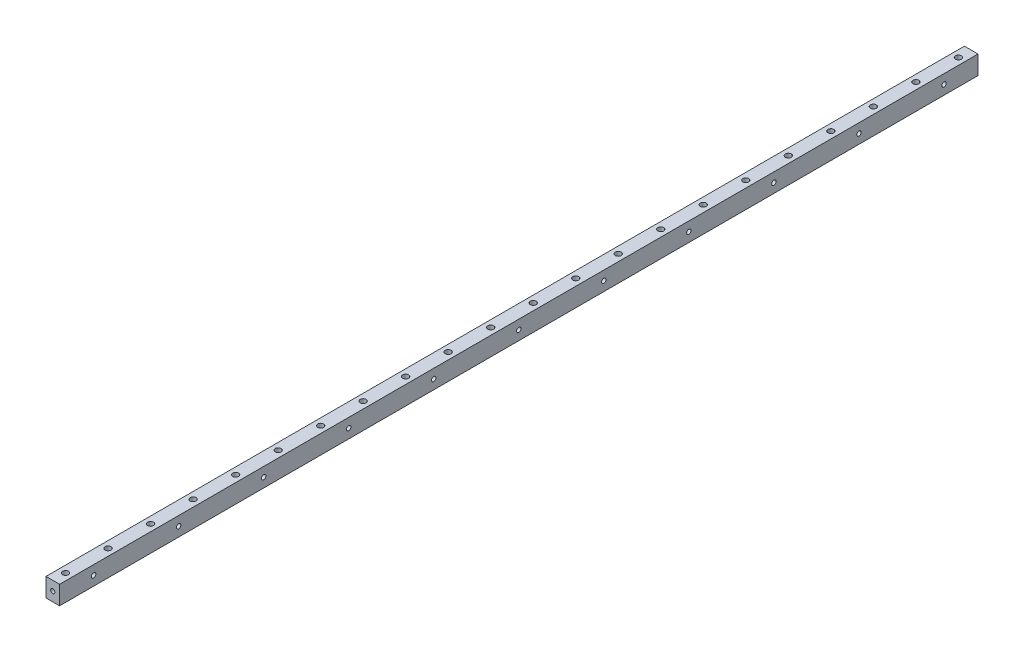
from build123d import *

# Parameters (mm, degrees)
SKETCH1_W             = 8
SKETCH1_H             = 11
BOSS_EXTRUDE1_DEPTH   = 540
SKETCH2_R             = 1.75
CUT_EXTRUDE1_DEPTH    = 541.126836956
LPATTERN1_COUNT       = 22
LPATTERN1_PITCH       = 25
SKETCH3_R             = 1.3
CUT_EXTRUDE2_DEPTH    = 541.087261468
LPATTERN2_COUNT       = 11
LPATTERN2_PITCH       = 50
M3_TAPPED_HOLE1_D     = 2.5
M3_TAPPED_HOLE1_DEPTH = 7.5
M3_TAPPED_HOLE1_TIP   = 0.751075774
M3_TAPPED_HOLE2_D     = 2.5
M3_TAPPED_HOLE2_DEPTH = 7.5
M3_TAPPED_HOLE2_TIP   = 0.751075774


with BuildPart() as part:
    # Sketch1 → Boss-Extrude1 (new body)
    with BuildSketch(Plane.XY):
        Rectangle(SKETCH1_W, SKETCH1_H)
    extrude(amount=BOSS_EXTRUDE1_DEPTH)

    # Sketch2 → Cut-Extrude1 (cut, through all)
    with BuildSketch(Plane(origin=(0, 5.5, 0), x_dir=(1, 0, 0), z_dir=(0, 1, 0))):
        with Locations((0, -7.5)):
            Circle(SKETCH2_R)
    cut_extrude1 = extrude(amount=-CUT_EXTRUDE1_DEPTH, mode=Mode.SUBTRACT)

    # LPattern1: Cut-Extrude1 ×22
    with Locations(*[(0, 0, i * LPATTERN1_PITCH) for i in range(1, LPATTERN1_COUNT)]):
        add(cut_extrude1, mode=Mode.SUBTRACT)

    # Sketch3 → Cut-Extrude2 (cut, through all)
    with BuildSketch(Plane.ZY.offset(4)):
        with Locations((20, 0)):
            Circle(SKETCH3_R)
    cut_extrude2 = extrude(amount=-CUT_EXTRUDE2_DEPTH, mode=Mode.SUBTRACT)

    # LPattern2: Cut-Extrude2 ×11
    with Locations(*[(0, 0, i * LPATTERN2_PITCH) for i in range(1, LPATTERN2_COUNT)]):
        add(cut_extrude2, mode=Mode.SUBTRACT)

    # M3 Tapped Hole1
    with Locations(Plane(origin=(0, 0, 0), x_dir=(-1, 0, 0), z_dir=(0, 0, -1))):
        with Locations((0, 0)):
            Hole(M3_TAPPED_HOLE1_D / 2, depth=M3_TAPPED_HOLE1_DEPTH)
            with Locations((0, 0, -(M3_TAPPED_HOLE1_DEPTH + M3_TAPPED_HOLE1_TIP / 2))):  # 118° drill point
                Cone(0, M3_TAPPED_HOLE1_D / 2, M3_TAPPED_HOLE1_TIP, mode=Mode.SUBTRACT)

    # M3 Tapped Hole2
    with Locations(Plane.XY.offset(540)):
        with Locations((0, 0)):
            Hole(M3_TAPPED_HOLE2_D / 2, depth=M3_TAPPED_HOLE2_DEPTH)
            with Locations((0, 0, -(M3_TAPPED_HOLE2_DEPTH + M3_TAPPED_HOLE2_TIP / 2))):  # 118° drill point
                Cone(0, M3_TAPPED_HOLE2_D / 2, M3_TAPPED_HOLE2_TIP, mode=Mode.SUBTRACT)


solid = part.part
